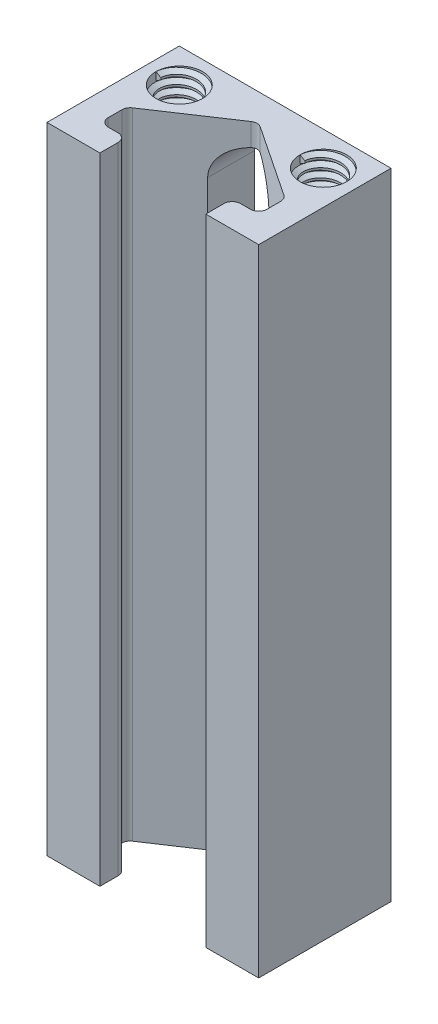
from build123d import *
from build123d.topology import SkipClean

# Parameters (mm, degrees)
BOSS_EXTRUDE1_DEPTH     = 127
BOSS_EXTRUDE2_DEPTH     = 76.2
FILLET1_R               = 1
CUT_EXTRUDE1_DEPTH      = 166.676690047
CUT_EXTRUDE1_DEPTH_BACK = 166.676690047
SKETCH6_R               = 2.7987
CUT_EXTRUDE2_DEPTH      = 25.4
THREAD1_PITCH           = 1.058333333
THREAD2_PITCH           = 1.058333333


with BuildPart() as part:
    # Sketch2 → Boss-Extrude1 (new body)
    with BuildSketch(Plane.XY):
        with BuildLine():
            Line((-71.414284285, -70), (71.414284285, -70))
            ThreePointArc((71.414284285, -70), (0, -100), (-71.414284285, -70))
        make_face()
    extrude(amount=BOSS_EXTRUDE1_DEPTH)


with BuildPart() as body_2:
    # Sketch3 → Boss-Extrude2 (new body)
    with BuildSketch(Plane(origin=(0, 0, 0), x_dir=(1, 0, 0), z_dir=(0, 1, 0))):
        Polygon((-52.364284285, -127), (-52.364284285, -111.125), (-26.964284285, -111.125), (-26.964284285, -127), (-33.314284285, -127), (-33.314284285, -123.825), (-30.139284285, -123.825), (-30.139284285, -120.65), (-39.664284285, -114.3), (-49.189284285, -120.65), (-49.189284285, -123.825), (-46.014284285, -123.825), (-46.014284285, -127), align=None)
    extrude(amount=BOSS_EXTRUDE2_DEPTH)

    # Fillet1
    fillet1_edges = [body_2.edges().sort_by_distance(p)[0] for p in [
        (-33.314284285, 38.1, 123.825),
        (-30.139284285, 38.1, 123.825),
        (-30.139284285, 38.1, 120.65),
        (-39.664284285, 38.1, 114.3),
        (-49.189284285, 38.1, 120.65),
        (-49.189284285, 38.1, 123.825),
        (-46.014284285, 38.1, 123.825),
    ]]
    fillet(fillet1_edges, radius=FILLET1_R)

    # Sketch5 → Cut-Extrude1 (cut, two sides: drawn at the far end of the back side and taken through both)
    with BuildSketch(Plane(origin=(0, 0, 111.125), x_dir=(-1, 0, 0), z_dir=(0, 0, -1)).offset(-CUT_EXTRUDE1_DEPTH_BACK)):
        with BuildLine():
            Line((43.339284285, 69.85), (43.339284285, 6.35))
            ThreePointArc((43.339284285, 6.35), (39.664284285, 2.675), (35.989284285, 6.35))
            Line((35.989284285, 6.35), (35.989284285, 69.85))
            ThreePointArc((35.989284285, 69.85), (39.664284285, 73.525), (43.339284285, 69.85))
        make_face()
    extrude(amount=CUT_EXTRUDE1_DEPTH + CUT_EXTRUDE1_DEPTH_BACK, mode=Mode.SUBTRACT)

    # Sketch6 → Cut-Extrude2 (cut)
    with BuildSketch(Plane(origin=(0, 76.2, 0), x_dir=(1, 0, 0), z_dir=(0, 1, 0))):
        with Locations(Location((-48.305857477, -115.183426809, 0), (0, 0, 270))):
            Circle(SKETCH6_R)
        with Locations(Location((-31.022711094, -115.183426809, 0), (0, 0, 90))):
            Circle(SKETCH6_R)
    extrude(amount=-CUT_EXTRUDE2_DEPTH, mode=Mode.SUBTRACT)

    # Thread1: arcs per turn and ends read off the stored shape
    # Thread1: the profile of Thread Profile1 profile screwed along a right-hand helix through 24 turns, 8 arcs to a turn; built about Z, then put on its axis
    thread1_z = Axis((0, 0, 0), (0, 0, 1))
    thread1_corners = [(2.799, 0, -0.000173205), (2.799, 0, 0.926214869), (2.225860282, 0, 0.595312499), (2.225860282, 0, 0.330729165)]
    with BuildLine(mode=Mode.PRIVATE) as thread1_profile:
        Line(thread1_corners[0], thread1_corners[1])
        Line(thread1_corners[1], thread1_corners[2])
        Line(thread1_corners[2], thread1_corners[3])
        Line(thread1_corners[3], thread1_corners[0])
    thread1_cap = Face(thread1_profile.wire())
    thread1_turn_angles = [0, 22.5, 45, 67.5, 90, 112.5, 135, 157.5, 180, 202.5, 225, 247.5, 270, 292.5, 315, 337.5, 360]
    thread1_turn_weights = [1, 0.9238795325112867, 1, 0.9238795325112867, 1, 0.9238795325112867, 1, 0.9238795325112867, 1, 0.9238795325112867, 1, 0.9238795325112867, 1, 0.9238795325112867, 1, 0.9238795325112867, 1]
    thread1_turn_rails = [Edge.make_bspline([Vector(p[0], p[1], 0).rotate(thread1_z, thread1_turn_angles[k]) / thread1_turn_weights[k] + Vector(0, 0, p[2] + THREAD1_PITCH * thread1_turn_angles[k] / 360) for k in range(17)], [0, 0, 0, 1, 1, 2, 2, 3, 3, 4, 4, 5, 5, 6, 6, 7, 7, 8, 8, 8], 2, thread1_turn_weights) for p in thread1_corners]
    thread1_turn_sides = [Face.make_surface_from_curves(thread1_turn_rails[p[0]], thread1_turn_rails[p[1]]) for p in [(0, 1), (1, 2), (2, 3), (3, 0)]]
    thread1 = Plane(origin=(-48.305857477, 76.2, 115.183426809), x_dir=(-1, 0, 0), z_dir=(0, -1, 0)) * Solid(Shell([*[p.moved(Location((0, 0, THREAD1_PITCH * i))) for i in range(24) for p in thread1_turn_sides], thread1_cap, thread1_cap.rotate(thread1_z, 8640).moved(Location((0, 0, THREAD1_PITCH * 8640 / 360)))]))
    add(thread1)

    # Thread2: arcs per turn and ends read off the stored shape
    # Thread2: the profile of Thread Profile2 profile screwed along a right-hand helix through 24 turns, 8 arcs to a turn; built about Z, then put on its axis
    with SkipClean():  # the faces are left unmerged after this step: merging them gives an invalid solid
        thread2_z = Axis((0, 0, 0), (0, 0, 1))
        thread2_corners = [(2.799, 0, -0.000173205), (2.799, 0, 0.926214869), (2.225860282, 0, 0.595312499), (2.225860282, 0, 0.330729165)]
        with BuildLine(mode=Mode.PRIVATE) as thread2_profile:
            Line(thread2_corners[0], thread2_corners[1])
            Line(thread2_corners[1], thread2_corners[2])
            Line(thread2_corners[2], thread2_corners[3])
            Line(thread2_corners[3], thread2_corners[0])
        thread2_cap = Face(thread2_profile.wire())
        thread2_turn_angles = [0, 22.5, 45, 67.5, 90, 112.5, 135, 157.5, 180, 202.5, 225, 247.5, 270, 292.5, 315, 337.5, 360]
        thread2_turn_weights = [1, 0.9238795325112867, 1, 0.9238795325112867, 1, 0.9238795325112867, 1, 0.9238795325112867, 1, 0.9238795325112867, 1, 0.9238795325112867, 1, 0.9238795325112867, 1, 0.9238795325112867, 1]
        thread2_turn_rails = [Edge.make_bspline([Vector(p[0], p[1], 0).rotate(thread2_z, thread2_turn_angles[k]) / thread2_turn_weights[k] + Vector(0, 0, p[2] + THREAD2_PITCH * thread2_turn_angles[k] / 360) for k in range(17)], [0, 0, 0, 1, 1, 2, 2, 3, 3, 4, 4, 5, 5, 6, 6, 7, 7, 8, 8, 8], 2, thread2_turn_weights) for p in thread2_corners]
        thread2_turn_sides = [Face.make_surface_from_curves(thread2_turn_rails[p[0]], thread2_turn_rails[p[1]]) for p in [(0, 1), (1, 2), (2, 3), (3, 0)]]
        thread2 = Plane(origin=(-31.022711094, 76.2, 115.183426809), x_dir=(-1, 0, 0), z_dir=(0, -1, 0)) * Solid(Shell([*[p.moved(Location((0, 0, THREAD2_PITCH * i))) for i in range(24) for p in thread2_turn_sides], thread2_cap, thread2_cap.rotate(thread2_z, 8640).moved(Location((0, 0, THREAD2_PITCH * 8640 / 360)))]))
        add(thread2)


solid = body_2.part
